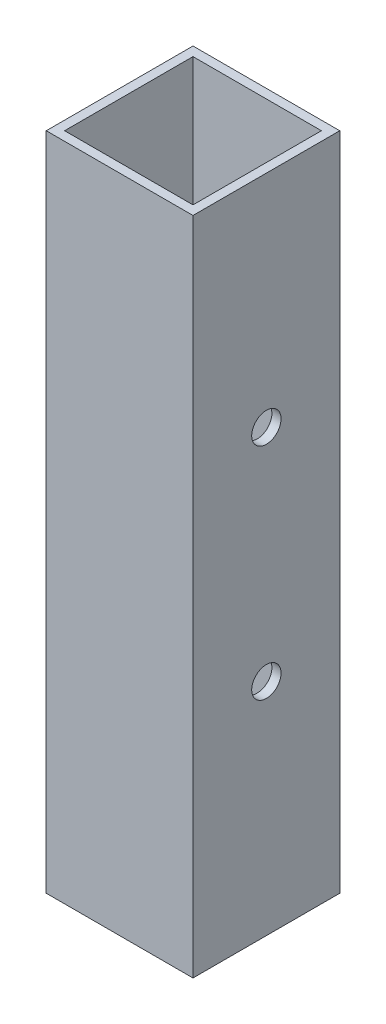
from build123d import *

# Parameters (mm, degrees)
SKETCH1_W           = 25.4
SKETCH1_H           = 25.4
SKETCH1_W_2         = 22.225
SKETCH1_H_2         = 22.225
BOSS_EXTRUDE1_DEPTH = 114.3
SKETCH3_R           = 2.54
CUT_EXTRUDE1_DEPTH  = 118.774954893


with BuildPart() as part:
    # Sketch1 → Boss-Extrude1 (new body)
    with BuildSketch(Plane(origin=(0, 0, 0), x_dir=(1, 0, 0), z_dir=(0, 1, 0))):
        Rectangle(SKETCH1_W, SKETCH1_H)
        Rectangle(SKETCH1_W_2, SKETCH1_H_2, mode=Mode.SUBTRACT)
    extrude(amount=BOSS_EXTRUDE1_DEPTH)

    # Sketch3 → Cut-Extrude1 (cut, through all)
    with BuildSketch(Plane(origin=(12.7, 0, 0), x_dir=(0, 0, -1), z_dir=(1, 0, 0))):
        with Locations((0, 76.2)):
            Circle(SKETCH3_R)
        with Locations((0, 38.1)):
            Circle(SKETCH3_R)
    extrude(amount=-CUT_EXTRUDE1_DEPTH, mode=Mode.SUBTRACT)


solid = part.part
